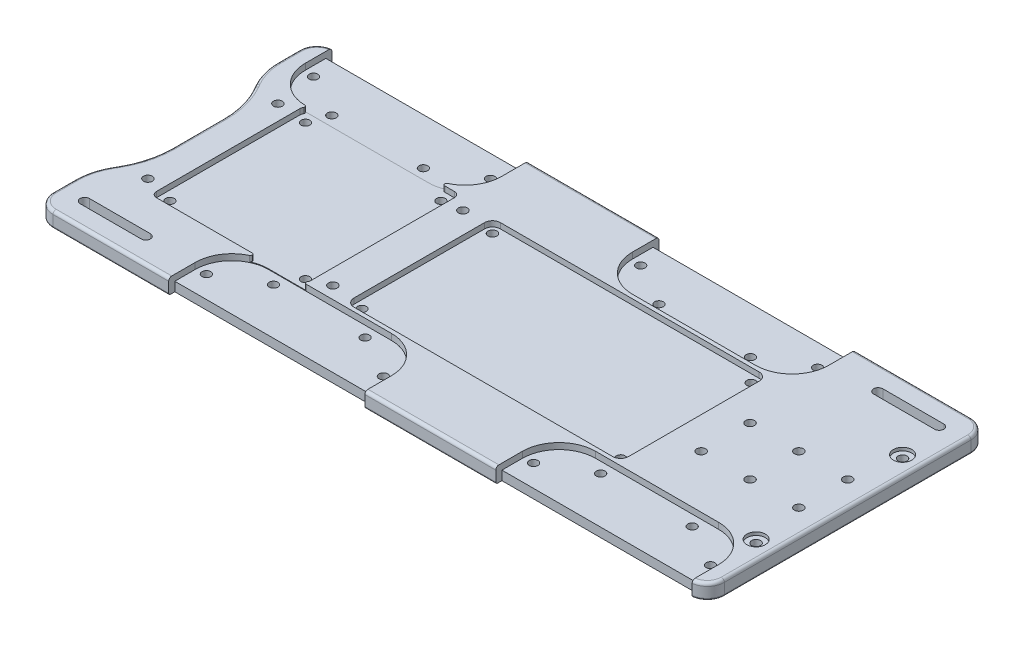
from build123d import *

# Parameters (mm, degrees)
SKETCH_1_W           = 210
SKETCH_1_H           = 92
EXTRUDE_1_DEPTH      = 5
SKETCH_7_R           = 1.425
CUT_EXTRUDE_2_DEPTH  = 10
SKETCH_9_W           = 92
SKETCH_9_H           = 5
EXTRUDE_2_DEPTH      = 5
SKETCH_10_W          = 92
SKETCH_10_H          = 5
EXTRUDE_3_DEPTH      = 5
CUT_EXTRUDE_4_DEPTH  = 5
FILLET_1_R           = 20
FILLET_2_R           = 28
FILLET_3_R           = 5.6
SKETCH_13_W          = 50.6
SKETCH_13_H          = 50.6
CUT_EXTRUDE_5_DEPTH  = 1.8
FILLET_4_R           = 1.8
SKETCH_14_R          = 1.425
CUT_EXTRUDE_6_DEPTH  = 3
SKETCH_15_W          = 90
SKETCH_15_H          = 48
CUT_EXTRUDE_7_DEPTH  = 1.8
FILLET_5_R           = 2.6
SKETCH_16_R          = 1.45
CUT_EXTRUDE_8_DEPTH  = 3
SKETCH_18_R          = 1.45
CUT_EXTRUDE_9_DEPTH  = 120.335661057
SKETCH_19_R          = 3.025
CUT_EXTRUDE_10_DEPTH = 1.04
FILLET_6_R           = 0.6
CUT_EXTRUDE_11_DEPTH = 2
FILLET_7_R           = 0.6
SKETCH_21_W          = 64.3
SKETCH_21_H          = 2
CUT_EXTRUDE_14_DEPTH = 120.335661192
SKETCH_23_R          = 1.45
CUT_EXTRUDE_15_DEPTH = 10
FILLET_8_R           = 1


with BuildPart() as part:
    # 草图1 → 凸台-拉伸1 (new body)
    with BuildSketch(Plane(origin=(0, 0, 0), x_dir=(1, 0, 0), z_dir=(0, 1, 0))):
        Rectangle(SKETCH_1_W, SKETCH_1_H)
    extrude(amount=EXTRUDE_1_DEPTH)

    # 草图7 → 切除-拉伸2 (cut)
    with BuildSketch(Plane.XZ):
        with Locations(Location((-101.85, -36.8, 0), (0, 0, 270))):
            Circle(SKETCH_7_R)
        with Locations(Location((-87.85, -28.8, 0), (0, 0, 270))):
            Circle(SKETCH_7_R)
        with Locations(Location((-57.85, -28.8, 0), (0, 0, 270))):
            Circle(SKETCH_7_R)
        with Locations(Location((-43.85, -36.8, 0), (0, 0, 270))):
            Circle(SKETCH_7_R)
        with Locations(Location((5.35, -36.8, 0), (0, 0, 270))):
            Circle(SKETCH_7_R)
        with Locations(Location((19.35, -28.8, 0), (0, 0, 270))):
            Circle(SKETCH_7_R)
        with Locations(Location((49.35, -28.8, 0), (0, 0, 270))):
            Circle(SKETCH_7_R)
        with Locations(Location((63.35, -36.8, 0), (0, 0, 270))):
            Circle(SKETCH_7_R)
        with Locations(Location((101.85, 36.8, 0), (0, 0, 270))):
            Circle(SKETCH_7_R)
        with Locations(Location((87.85, 28.8, 0), (0, 0, 270))):
            Circle(SKETCH_7_R)
        with Locations(Location((57.85, 28.8, 0), (0, 0, 270))):
            Circle(SKETCH_7_R)
        with Locations(Location((43.85, 36.8, 0), (0, 0, 270))):
            Circle(SKETCH_7_R)
        with Locations(Location((-5.35, 36.8, 0), (0, 0, 270))):
            Circle(SKETCH_7_R)
        with Locations(Location((-19.35, 28.8, 0), (0, 0, 270))):
            Circle(SKETCH_7_R)
        with Locations(Location((-49.35, 28.8, 0), (0, 0, 270))):
            Circle(SKETCH_7_R)
        with Locations(Location((-63.35, 36.8, 0), (0, 0, 270))):
            Circle(SKETCH_7_R)
    extrude(amount=-CUT_EXTRUDE_2_DEPTH, mode=Mode.SUBTRACT)

    # 草图9 → 凸台-拉伸2 (add)
    with BuildSketch(Plane.ZY.offset(105)):
        with Locations((0, 2.5)):
            Rectangle(SKETCH_9_W, SKETCH_9_H)
    extrude(amount=EXTRUDE_2_DEPTH)

    # 草图10 → 凸台-拉伸3 (add)
    with BuildSketch(Plane(origin=(105, 0, 0), x_dir=(0, 0, -1), z_dir=(1, 0, 0))):
        with Locations((0, 2.5)):
            Rectangle(SKETCH_10_W, SKETCH_10_H)
    extrude(amount=EXTRUDE_3_DEPTH)

    # 草图11 → 切除-拉伸4 (cut)
    with BuildSketch(Plane(origin=(0, 5, 0), x_dir=(1, 0, 0), z_dir=(0, 1, 0))):
        Polygon((-110, 0), (-110, 28), (-103, 15.875644347), (-103, -15.875644347), (-110, -28), align=None)
    extrude(amount=-CUT_EXTRUDE_4_DEPTH, mode=Mode.SUBTRACT)

    # 圆角1
    fillet_1_edges = [part.edges().sort_by_distance(p)[0] for p in [
        (-110, 2.5, 28),
        (-110, 2.5, -28),
    ]]
    fillet(fillet_1_edges, radius=FILLET_1_R)

    # 圆角2
    fillet_2_edges = [part.edges().sort_by_distance(p)[0] for p in [
        (-103, 2.5, -15.875644347),
        (-103, 2.5, 15.875644347),
    ]]
    fillet(fillet_2_edges, radius=FILLET_2_R)

    # 圆角3
    fillet_3_edges = [part.edges().sort_by_distance(p)[0] for p in [
        (-110, 2.5, -46),
        (-110, 2.5, 46),
        (110, 2.5, 46),
        (110, 2.5, -46),
    ]]
    fillet(fillet_3_edges, radius=FILLET_3_R)

    # 草图13 → 切除-拉伸5 (cut)
    with BuildSketch(Plane(origin=(0, 5, 0), x_dir=(1, 0, 0), z_dir=(0, 1, 0))):
        with Locations((-67.7, 0)):
            Rectangle(SKETCH_13_W, SKETCH_13_H)
    extrude(amount=-CUT_EXTRUDE_5_DEPTH, mode=Mode.SUBTRACT)

    # 圆角4
    fillet_4_edges = [part.edges().sort_by_distance(p)[0] for p in [
        (-42.4, 4.1, -25.3),
        (-42.4, 4.1, 25.3),
        (-93, 4.1, 25.3),
        (-93, 4.1, -25.3),
    ]]
    fillet(fillet_4_edges, radius=FILLET_4_R)

    # 草图14 → 切除-拉伸6 (cut)
    with BuildSketch(Plane(origin=(0, 3.2, 0), x_dir=(1, 0, 0), z_dir=(0, 1, 0))):
        with Locations(Location((-89.9, 22.2, 0), (0, 0, 270))):
            Circle(SKETCH_14_R)
        with Locations(Location((-45.5, 22.2, 0), (0, 0, 90))):
            Circle(SKETCH_14_R)
        with Locations(Location((-45.5, -22.2, 0), (0, 0, 270))):
            Circle(SKETCH_14_R)
        with Locations(Location((-89.9, -22.2, 0), (0, 0, 90))):
            Circle(SKETCH_14_R)
    extrude(amount=-CUT_EXTRUDE_6_DEPTH, mode=Mode.SUBTRACT)

    # 草图15 → 切除-拉伸7 (cut)
    with BuildSketch(Plane(origin=(0, 5, 0), x_dir=(1, 0, 0), z_dir=(0, 1, 0))):
        with Locations((14.6, 0)):
            Rectangle(SKETCH_15_W, SKETCH_15_H)
    extrude(amount=-CUT_EXTRUDE_7_DEPTH, mode=Mode.SUBTRACT)

    # 圆角5
    fillet_5_edges = [part.edges().sort_by_distance(p)[0] for p in [
        (59.6, 4.1, -24),
        (59.6, 4.1, 24),
        (-30.4, 4.1, 24),
        (-30.4, 4.1, -24),
    ]]
    fillet(fillet_5_edges, radius=FILLET_5_R)

    # 草图16 → 切除-拉伸8 (cut)
    with BuildSketch(Plane(origin=(0, 3.2, 0), x_dir=(1, 0, 0), z_dir=(0, 1, 0))):
        with Locations(Location((-27.8, -21.4, 0), (0, 0, 270))):
            Circle(SKETCH_16_R)
        with Locations(Location((-27.8, 21.4, 0), (0, 0, 90))):
            Circle(SKETCH_16_R)
        with Locations(Location((57, -21.4, 0), (0, 0, 90))):
            Circle(SKETCH_16_R)
        with Locations(Location((57, 21.4, 0), (0, 0, 270))):
            Circle(SKETCH_16_R)
    extrude(amount=-CUT_EXTRUDE_8_DEPTH, mode=Mode.SUBTRACT)

    # 草图18 → 切除-拉伸9 (cut, through all)
    with BuildSketch(Plane(origin=(0, 5, 0), x_dir=(1, 0, 0), z_dir=(0, 1, 0))):
        with Locations(Location((102, 8, 0), (0, 0, 270))):
            Circle(SKETCH_18_R)
        with Locations(Location((86, 8, 0), (0, 0, 270))):
            Circle(SKETCH_18_R)
        with Locations(Location((70, 8, 0), (0, 0, 270))):
            Circle(SKETCH_18_R)
        with Locations(Location((102, -8, 0), (0, 0, 90))):
            Circle(SKETCH_18_R)
        with Locations(Location((86, -8, 0), (0, 0, 90))):
            Circle(SKETCH_18_R)
        with Locations(Location((70, -8, 0), (0, 0, 90))):
            Circle(SKETCH_18_R)
        with Locations(Location((104, 24, 0), (0, 0, 270))):
            Circle(SKETCH_18_R)
        with Locations(Location((104, -24, 0), (0, 0, 90))):
            Circle(SKETCH_18_R)
        with BuildLine():
            Line((102, 36.5), (82, 36.5))
            ThreePointArc((82, 36.5), (80.5, 38), (82, 39.5))
            Line((82, 39.5), (102, 39.5))
            ThreePointArc((102, 39.5), (103.5, 38), (102, 36.5))
        make_face()
        with BuildLine():
            Line((-102, -36.5), (-82, -36.5))
            ThreePointArc((-82, -36.5), (-80.5, -38), (-82, -39.5))
            Line((-82, -39.5), (-102, -39.5))
            ThreePointArc((-102, -39.5), (-103.5, -38), (-102, -36.5))
        make_face()
    extrude(amount=-CUT_EXTRUDE_9_DEPTH, mode=Mode.SUBTRACT)

    # 草图19 → 切除-拉伸10 (cut)
    with BuildSketch(Plane(origin=(0, 5, 0), x_dir=(1, 0, 0), z_dir=(0, 1, 0))):
        with Locations(Location((104, 24, 0), (0, 0, 270))):
            Circle(SKETCH_19_R)
        with Locations(Location((104, -24, 0), (0, 0, 270))):
            Circle(SKETCH_19_R)
    extrude(amount=-CUT_EXTRUDE_10_DEPTH, mode=Mode.SUBTRACT)

    # 圆角6
    fillet_6_edges = [part.edges().sort_by_distance(p)[0] for p in [
        (-107.035898385, 0, 22.866025404),
        (-110, 0, 36.879491924),
        (-109.318516526, 0, -28.182602947),
        (-109.318516526, 0, 28.182602947),
        (-103, 0, 0),
        (-107.035898385, 0, -22.866025404),
        (-103.954076864, 0, 15.620000222),
        (-103.954076864, 0, -15.620000222),
        (110, 0, 0),
        (0, 0, -46),
        (-110, 0, -36.879491924),
        (0, 0, 46),
        (-108.359797975, 0, 44.359797975),
        (-108.359797975, 0, -44.359797975),
        (108.359797975, 0, 44.359797975),
        (108.359797975, 0, -44.359797975),
    ]]
    fillet(fillet_6_edges, radius=FILLET_6_R)

    # 草图22 → 切除-拉伸11 (cut)
    with BuildSketch(Plane(origin=(0, 5, 0), x_dir=(1, 0, 0), z_dir=(0, 1, 0))):
        with BuildLine():
            Line((-105, 46), (-40.7, 46))
            Line((-40.7, 46), (-40.7, 37.3))
            ThreePointArc((-40.7, 37.3), (-44.214718626, 28.814718626), (-52.7, 25.3))
            Line((-52.7, 25.3), (-93, 25.3))
            ThreePointArc((-93, 25.3), (-101.485281374, 28.814718626), (-105, 37.3))
            Line((-105, 37.3), (-105, 46))
        make_face()
        with BuildLine():
            Line((2.2, 46), (66.5, 46))
            Line((66.5, 46), (66.5, 37.3))
            ThreePointArc((66.5, 37.3), (62.985281374, 28.814718626), (54.5, 25.3))
            Line((54.5, 25.3), (14.2, 25.3))
            ThreePointArc((14.2, 25.3), (5.714718626, 28.814718626), (2.2, 37.3))
            Line((2.2, 37.3), (2.2, 46))
        make_face()
        with BuildLine():
            Line((105, -46), (40.7, -46))
            Line((40.7, -46), (40.7, -37.3))
            ThreePointArc((40.7, -37.3), (44.214718626, -28.814718626), (52.7, -25.3))
            Line((52.7, -25.3), (93, -25.3))
            ThreePointArc((93, -25.3), (101.485281374, -28.814718626), (105, -37.3))
            Line((105, -37.3), (105, -46))
        make_face()
        with BuildLine():
            Line((-66.5, -46), (-66.5, -37.3))
            ThreePointArc((-66.5, -37.3), (-62.985281374, -28.814718626), (-54.5, -25.3))
            Line((-54.5, -25.3), (-14.2, -25.3))
            ThreePointArc((-14.2, -25.3), (-5.714718626, -28.814718626), (-2.2, -37.3))
            Line((-2.2, -37.3), (-2.2, -46))
            Line((-2.2, -46), (-66.5, -46))
        make_face()
    extrude(amount=-CUT_EXTRUDE_11_DEPTH, mode=Mode.SUBTRACT)

    # 圆角7
    fillet_7_edges = [part.edges().sort_by_distance(p)[0] for p in [
        (-54.5, 4.1, 25.3),
    ]]
    fillet(fillet_7_edges, radius=FILLET_7_R)
    fillet_7_2_edges = [part.edges().sort_by_distance(p)[0] for p in [
        (-52.7, 4.1, -25.3),
    ]]
    fillet(fillet_7_2_edges, radius=FILLET_7_R)
    fillet_7_3_edges = [part.edges().sort_by_distance(p)[0] for p in [
        (-44.2, 4.1, 25.3),
    ]]
    fillet(fillet_7_3_edges, radius=FILLET_7_R)
    # the kernel refuses this fillet: 0.6 mm, written as the material it takes off along each edge
    with BuildSketch(Plane(origin=(-91.2, 10.158823254, -25.3), x_dir=(-0.999999016592618, 0, -0.0014024313874355916), z_dir=(0, -1, 0))) as fillet_7_4_piece_1:
        with BuildLine():
            CenterArc((2.075864396, -0.599873191), FILLET_7_R, 91.177997773, 118.825449161)
            Line((1.556267203, -0.899904451), (1.504307484, -0.929907577))
            ThreePointArc((1.504307484, -0.929907577), (0.868486751, -0.293698255), (-8.4146e-05, -0.059999941))
            Line((-8.4146e-05, -0.059999941), (8.4146e-05, 0.059999941))
            ThreePointArc((8.4146e-05, 0.059999941), (1.800082376, 0.057475564), (2.062295792, 0.059987319))
            Line((2.062295792, 0.059987319), (2.063529302, 0))
        make_face()
    extrude(amount=6.958823254, mode=Mode.SUBTRACT)

    # 草图21 → 切除-拉伸14 (cut, through all)
    with BuildSketch(Plane.XZ):
        with Locations((-34.35, 45)):
            Rectangle(SKETCH_21_W, SKETCH_21_H)
        with Locations((72.85, 45)):
            Rectangle(SKETCH_21_W, SKETCH_21_H)
        with Locations((34.35, -45)):
            Rectangle(SKETCH_21_W, SKETCH_21_H)
        with Locations((-72.85, -45)):
            Rectangle(SKETCH_21_W, SKETCH_21_H)
    extrude(amount=-CUT_EXTRUDE_14_DEPTH, mode=Mode.SUBTRACT)

    # 草图23 → 切除-拉伸15 (cut)
    with BuildSketch(Plane(origin=(0, 5, 0), x_dir=(1, 0, 0), z_dir=(0, 1, 0))):
        with Locations(Location((-37.4, 21.3, 0), (0, 0, 270))):
            Circle(SKETCH_23_R)
        with Locations(Location((-37.4, -21.3, 0), (0, 0, 270))):
            Circle(SKETCH_23_R)
        with Locations(Location((-98, -21.3, 0), (0, 0, 270))):
            Circle(SKETCH_23_R)
        with Locations(Location((-98, 21.3, 0), (0, 0, 270))):
            Circle(SKETCH_23_R)
    extrude(amount=-CUT_EXTRUDE_15_DEPTH, mode=Mode.SUBTRACT)

    # 圆角8
    fillet_8_edges = [part.edges().sort_by_distance(p)[0] for p in [
        (-107.035898385, 5, 22.866025404),
        (-110, 5, -36.879491924),
        (-109.318516526, 5, -28.182602947),
        (-109.318516526, 5, 28.182602947),
        (-103, 5, 0),
        (-107.035898385, 5, -22.866025404),
        (-103.954076864, 5, 15.620000222),
        (-103.954076864, 5, -15.620000222),
        (110, 5, 0),
        (-110, 5, 36.879491924),
        (-85.45, 5, 46),
        (85.45, 5, -46),
        (-108.359797975, 5, 44.359797975),
        (108.359797975, 5, -44.359797975),
        (-108.566533331, 5, -44.141657387),
        (108.566533331, 5, 44.141657387),
        (19.25, 5, 46),
        (-19.25, 5, -46),
    ]]
    fillet(fillet_8_edges, radius=FILLET_8_R)


solid = part.part
